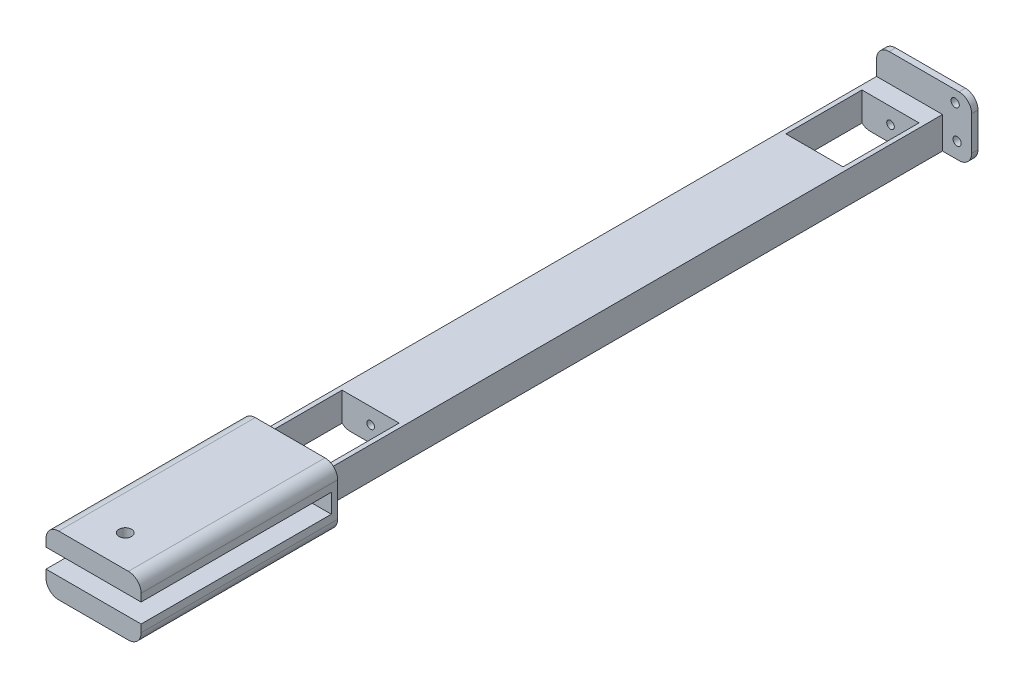
from build123d import *

# Parameters (mm, degrees)
SKETCH1_W                = 520
SKETCH1_H                = 250
BOSS_EXTRUDE1_DEPTH      = 5000
SKETCH2_W                = 450
SKETCH2_H                = 250
CUT_EXTRUDE1_DEPTH       = 600
SKETCH3_W                = 750
SKETCH3_H                = 470
BOSS_EXTRUDE2_DEPTH      = 50
SKETCH4_R                = 32.5
CUT_EXTRUDE2_DEPTH       = 50
CUT_EXTRUDE3_DEPTH       = 4937.509394299
CUT_EXTRUDE3_DEPTH_BACK  = 170
SKETCH5_R                = 30
SCALE2_SCALE             = 0.1
FILLET1_R                = 10
BOSS_EXTRUDE9_DEPTH      = 150
BOSS_EXTRUDE9_DEPTH_BACK = 1
CUT_EXTRUDE4_DEPTH       = 2907.266833376
CUT_EXTRUDE4_DEPTH_BACK  = 2907.266833376
SKETCH7_R                = 5
SKETCH8_R                = 3.25
CUT_EXTRUDE5_DEPTH       = 20


with BuildPart() as part:
    # Sketch1 → Boss-Extrude1 (new body)
    with BuildSketch(Plane.XY):
        Rectangle(SKETCH1_W, SKETCH1_H)
    extrude(amount=BOSS_EXTRUDE1_DEPTH)

    # Sketch2 → Cut-Extrude1 (cut)
    with BuildSketch(Plane.XY.offset(4850)):
        Rectangle(SKETCH2_W, SKETCH2_H)
    cut_extrude1 = extrude(amount=-CUT_EXTRUDE1_DEPTH, mode=Mode.SUBTRACT)

    # Mirror1: Cut-Extrude1 across plane
    add(cut_extrude1.mirror(Plane.XY.offset(2500)), mode=Mode.SUBTRACT)

    # Sketch3 → Boss-Extrude2 (add)
    with BuildSketch(Plane.XY.offset(5000)):
        with Locations((115, 110)):
            Rectangle(SKETCH3_W, SKETCH3_H)
    boss_extrude2 = extrude(amount=BOSS_EXTRUDE2_DEPTH)

    # Sketch4 → Cut-Extrude2 (cut)
    with BuildSketch(Plane.XY.offset(5050)):
        with Locations((375, 0)):
            Circle(SKETCH4_R)
        with Locations((360, 255)):
            Circle(SKETCH4_R)
    cut_extrude2 = extrude(amount=-CUT_EXTRUDE2_DEPTH, mode=Mode.SUBTRACT)

    # Mirror2: Boss-Extrude2, Cut-Extrude2 across plane
    add(boss_extrude2.mirror(Plane.XY.offset(2500)))
    add(cut_extrude2.mirror(Plane.XY.offset(2500)), mode=Mode.SUBTRACT)

    # Sketch5 → Cut-Extrude3 (cut, two sides: drawn at the far end of the back side and taken through both)
    with BuildSketch(Plane(origin=(0, 0, 4850), x_dir=(-1, 0, 0), z_dir=(0, 0, -1)).offset(-CUT_EXTRUDE3_DEPTH_BACK)):
        with Locations(Location((0, 0, 0), (0, 0, 180))):
            Circle(SKETCH5_R)
    extrude(amount=CUT_EXTRUDE3_DEPTH + CUT_EXTRUDE3_DEPTH_BACK, mode=Mode.SUBTRACT)


with BuildPart() as part_1:
    # Scale2: scaled about (7.073044916, 7.041537563, 2500.399199176)
    add(part.part.scale(SCALE2_SCALE).moved(Location((6.365740424, 6.337383807, 2250.359279258))))

    # Fillet1
    # the kernel refuses this fillet: 10 mm, written as the material it takes off along each edge
    with BuildSketch(Plane(origin=(-19.634259576, 40.837383807, 2725.359279258), x_dir=(0, -1, 0), z_dir=(0, 0, 1)), Plane(origin=(55.365740424, 40.837383807, 2725.359279258), x_dir=(-1, 0, 0), z_dir=(0, 0, 1)), Plane(origin=(55.365740424, -6.162616193, 2275.359279258), x_dir=(-1, 0, 0), z_dir=(0, 0, -1))) as fillet1_piece_1:
        with BuildLine():
            CenterArc((FILLET1_R, FILLET1_R), FILLET1_R, 180, 90)
            Line((0, FILLET1_R), (0, 0))
            Line((0, 0), (FILLET1_R, 0))
        make_face()
    extrude(amount=55, mode=Mode.SUBTRACT)
    with BuildSketch(Plane(origin=(55.365740424, -6.162616193, 2725.359279258), x_dir=(-1, 0, 0), z_dir=(0, 0, 1)), Plane(origin=(-19.634259576, 40.837383807, 2275.359279258), x_dir=(0, -1, 0), z_dir=(0, 0, -1)), Plane(origin=(55.365740424, 40.837383807, 2275.359279258), x_dir=(-1, 0, 0), z_dir=(0, 0, -1))) as fillet1_piece_2:
        with BuildLine():
            CenterArc((FILLET1_R, -FILLET1_R), FILLET1_R, 90, 90)
            Line((0, -FILLET1_R), (0, 0))
            Line((0, 0), (FILLET1_R, 0))
        make_face()
    extrude(amount=55, mode=Mode.SUBTRACT)
    with BuildSketch(Plane(origin=(-19.634259576, -6.162616193, 2220.359279258), x_dir=(0, 1, 0), z_dir=(0, 0, 1))) as fillet1_piece_3:
        with BuildLine():
            CenterArc((FILLET1_R, -FILLET1_R), FILLET1_R, 90, 90)
            Line((0, -FILLET1_R), (0, 0))
            Line((0, 0), (FILLET1_R, 0))
        make_face()
    extrude(amount=560, mode=Mode.SUBTRACT)

    # Sketch6 → Boss-Extrude9 (add, two sides: drawn at the far end of the back side and taken through both)
    with BuildSketch(Plane.XY.offset(2755.359279258).offset(-BOSS_EXTRUDE9_DEPTH_BACK)):
        with BuildLine():
            Line((-9.634259575, -6.162616194), (45.365740425, -6.162616194))
            ThreePointArc((45.365740425, -6.162616194), (52.436808237, -3.233684006), (55.365740425, 3.837383806))
            Line((55.365740425, 3.837383806), (55.365740425, 9.837383806))
            Line((55.365740425, 9.837383806), (-19.634259575, 9.837383806))
            Line((-19.634259575, 9.837383806), (-19.634259575, 3.837383806))
            ThreePointArc((-19.634259575, 3.837383806), (-16.705327387, -3.233684006), (-9.634259575, -6.162616194))
        make_face()
        with BuildLine():
            Line((-9.634259575, 40.837383806), (45.365740425, 40.837383806))
            ThreePointArc((45.365740425, 40.837383806), (52.436808237, 37.908451618), (55.365740425, 30.837383806))
            Line((55.365740425, 30.837383806), (55.365740425, 24.837383806))
            Line((55.365740425, 24.837383806), (-19.634259575, 24.837383806))
            Line((-19.634259575, 24.837383806), (-19.634259575, 30.837383806))
            ThreePointArc((-19.634259575, 30.837383806), (-16.705327387, 37.908451618), (-9.634259575, 40.837383806))
        make_face()
    extrude(amount=BOSS_EXTRUDE9_DEPTH + BOSS_EXTRUDE9_DEPTH_BACK)

    # Sketch7 → Cut-Extrude4 (cut, two sides: drawn at the far end of the back side and taken through both)
    with BuildSketch(Plane(origin=(0, 40.837383806, 0), x_dir=(1, 0, 0), z_dir=(0, 1, 0)).offset(-CUT_EXTRUDE4_DEPTH_BACK)):
        with Locations(Location((17.865740425, -2880.359279258, 0), (0, 0, 270))):
            Circle(SKETCH7_R)
    extrude(amount=CUT_EXTRUDE4_DEPTH + CUT_EXTRUDE4_DEPTH_BACK, mode=Mode.SUBTRACT)

    # Sketch8 → Cut-Extrude5 (cut)
    with BuildSketch(Plane(origin=(0, 0, 2754.359279258), x_dir=(-1, 0, 0), z_dir=(0, 0, -1))):
        with Locations(Location((-42.365740425, 31.837383806, 0), (0, 0, 180))):
            Circle(SKETCH8_R)
        with Locations(Location((-43.865740425, 6.337383806, 0), (0, 0, 180))):
            Circle(SKETCH8_R)
    extrude(amount=-CUT_EXTRUDE5_DEPTH, mode=Mode.SUBTRACT)


solid = part_1.part
